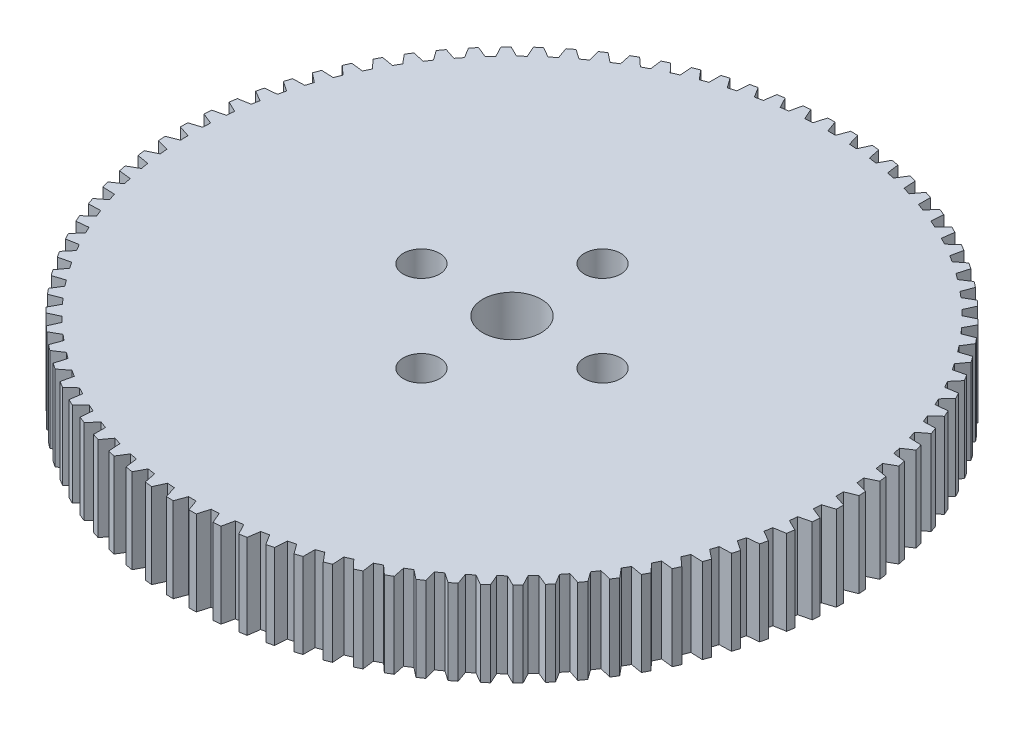
from build123d import *

# Parameters (mm, degrees)
TRACK_PROFILE_V2_DEPTH = 7.5
SKETCH1_R              = 2.575
SKETCH1_R_2            = 1.6
CUT_EXTRUDE1_DEPTH     = 42.834631051


# Read off the part's stored shape, not the designer's step: track_profile_v2
with BuildPart() as part:
    # track_profile_v2 outline → track_profile_v2 (new body)
    with BuildSketch(Plane(origin=(0, 0, 0), x_dir=(1, 0, 0), z_dir=(0, 1, 0))):
        with BuildLine():
            ThreePointArc((-22.430402101, -16.934228255), (-22.226959616, -17.200386369), (-22.020359088, -17.464100624))
            Line((-22.020359088, -17.464100624), (-22.584858875, -18.358245412))
            ThreePointArc((-22.584858875, -18.358245412), (-22.382148592, -18.604850158), (-22.17674576, -18.849216761))
            Line((-22.17674576, -18.849216761), (-21.19449072, -18.457643081))
            ThreePointArc((-21.19449072, -18.457643081), (-20.972977559, -18.708961417), (-20.748484524, -18.957621553))
            Line((-20.748484524, -18.957621553), (-21.24923683, -19.888965764))
            ThreePointArc((-21.24923683, -19.888965764), (-21.029818061, -20.120829439), (-20.807869428, -20.350272599))
            Line((-20.807869428, -20.350272599), (-19.855321911, -19.891134126))
            ThreePointArc((-19.855321911, -19.891134126), (-19.616817264, -20.126388286), (-19.375525428, -20.358782856))
            Line((-19.375525428, -20.358782856), (-19.810090639, -21.322789074))
            ThreePointArc((-19.810090639, -21.322789074), (-19.575032371, -21.538782061), (-19.337619248, -21.752183955))
            Line((-19.337619248, -21.752183955), (-18.419419969, -21.227717564))
            ThreePointArc((-18.419419969, -21.227717564), (-18.165085807, -21.445761414), (-17.90817072, -21.660758215))
            Line((-17.90817072, -21.660758215), (-18.274431677, -22.652729899))
            ThreePointArc((-18.274431677, -22.652729899), (-18.024879091, -22.851799902), (-17.77315813, -23.048120858))
            Line((-17.77315813, -23.048120858), (-16.893780465, -22.460881697))
            ThreePointArc((-16.893780465, -22.460881697), (-16.624855878, -22.660652948), (-16.353569205, -22.857204537))
            Line((-16.353569205, -22.857204537), (-16.649741522, -23.872308901))
            ThreePointArc((-16.649741522, -23.872308901), (-16.386910411, -24.053486071), (-16.122107973, -24.231769632))
            Line((-16.122107973, -24.231769632), (-15.285836161, -23.584618671))
            ThreePointArc((-15.285836161, -23.584618671), (-15.003631322, -23.765144059), (-14.719294744, -23.942292857))
            Line((-14.719294744, -23.942292857), (-14.943935499, -24.975584414))
            ThreePointArc((-14.943935499, -24.975584414), (-14.669106352, -25.137986074), (-14.392512526, -25.297363661))
            Line((-14.392512526, -25.297363661), (-13.603420799, -24.593453754))
            ThreePointArc((-13.603420799, -24.593453754), (-13.309310583, -24.753853777), (-13.013309359, -24.910736732))
            Line((-13.013309359, -24.910736732), (-13.165324125, -25.957181389))
            ThreePointArc((-13.165324125, -25.957181389), (-12.87983588, -26.100016335), (-12.592798205, -26.239711477))
            Line((-12.592798205, -26.239711477), (-11.854730939, -25.482472003))
            ThreePointArc((-11.854730939, -25.482472003), (-11.55014822, -25.621965207), (-11.243924438, -25.757818002))
            Line((-11.243924438, -25.757818002), (-11.322572615, -26.812317587))
            ThreePointArc((-11.322572615, -26.812317587), (-11.027816143, -26.934889941), (-10.731733037, -27.054222056))
            Line((-10.731733037, -27.054222056), (-10.048286021, -26.247342209))
            ThreePointArc((-10.048286021, -26.247342209), (-9.734714696, -26.365248999), (-9.419760248, -26.479409772))
            Line((-9.419760248, -26.479409772), (-9.424658669, -27.536826868))
            ThreePointArc((-9.424658669, -27.536826868), (-9.122069994, -27.63853947), (-8.818383944, -27.736927184))
            Line((-8.818383944, -27.736927184), (-8.192886863, -26.884338003))
            ThreePointArc((-8.192886863, -26.884338003), (-7.871854621, -26.980083948), (-7.549703933, -27.071996519))
            Line((-7.549703933, -27.071996519), (-7.480828734, -28.127179497))
            ThreePointArc((-7.480828734, -28.127179497), (-7.171882037, -28.207536813), (-6.862072571, -28.284500792))
            Line((-6.862072571, -28.284500792), (-6.297572785, -27.390356004))
            ThreePointArc((-6.297572785, -27.390356004), (-5.970643662, -27.463474639), (-5.64286622, -27.53269122))
            Line((-5.64286622, -27.53269122), (-5.500552953, -28.580499334))
            ThreePointArc((-5.500552953, -28.580499334), (-5.186753392, -28.639109872), (-4.87232987, -28.694275154))
            Line((-4.87232987, -28.694275154), (-4.371577564, -27.762930944))
            ThreePointArc((-4.371577564, -27.762930944), (-4.040344326, -27.813066043), (-3.708537029, -27.859249417))
            Line((-3.708537029, -27.859249417), (-3.493479031, -28.894577852))
            ThreePointArc((-3.493479031, -28.894577852), (-3.176355406, -28.931156066), (-2.858849668, -28.964253893))
            Line((-2.858849668, -28.964253893), (-2.424284458, -28.000247675))
            ThreePointArc((-2.424284458, -28.000247675), (-2.090360839, -28.027154985), (-1.756140219, -28.050080152))
            Line((-1.756140219, -28.050080152), (-1.469385231, -29.067884891))
            ThreePointArc((-1.469385231, -29.067884891), (-1.150482535, -29.082252577), (-0.831441438, -29.093121698))
            Line((-0.831441438, -29.093121698), (-0.465180481, -28.101150014))
            ThreePointArc((-0.465180481, -28.101150014), (-0.130193325, -28.104698445), (0.20481233, -28.104253716))
            Line((0.20481233, -28.104253716), (0.561867267, -29.099576117))
            ThreePointArc((0.561867267, -29.099576117), (0.880995371, -29.091663276), (1.200017492, -29.080250739))
            Line((1.200017492, -29.080250739), (1.496189809, -28.065146375))
            ThreePointArc((1.496189809, -28.065146375), (1.830608479, -28.04531864), (2.164767054, -28.02150618))
            Line((2.164767054, -28.02150618), (2.590382404, -28.989497133))
            ThreePointArc((2.590382404, -28.989497133), (2.908181156, -28.959342316), (3.225630056, -28.925703721))
            Line((3.225630056, -28.925703721), (3.450270812, -27.892412164))
            ThreePointArc((3.450270812, -27.892412164), (3.782491743, -27.849304861), (4.114175251, -27.802240683))
            Line((4.114175251, -27.802240683), (4.606277458, -28.738184232))
            ThreePointArc((4.606277458, -28.738184232), (4.921198575, -28.685934351), (5.235527676, -28.630233582))
            Line((5.235527676, -28.630233582), (5.387542442, -27.583788925))
            ThreePointArc((5.387542442, -27.583788925), (5.715947086, -27.517612068), (6.043539599, -27.447525464))
            Line((6.043539599, -27.447525464), (6.599731192, -28.346861787))
            ThreePointArc((6.599731192, -28.346861787), (6.910240409, -28.272771398), (7.219918331, -28.195279823))
            Line((7.219918331, -28.195279823), (7.298566507, -27.140780238))
            ThreePointArc((7.298566507, -27.140780238), (7.621554909, -27.051856235), (7.943460429, -26.959088661))
            Line((7.943460429, -26.959088661), (8.561031698, -27.817436281))
            ThreePointArc((8.561031698, -27.817436281), (8.865616246, -27.721866344), (9.169134269, -27.622961495))
            Line((9.169134269, -27.622961495), (9.17403269, -26.565544399))
            ThreePointArc((9.17403269, -26.565544399), (9.490031284, -26.454306478), (9.804681519, -26.339309887))
            Line((9.804681519, -26.339309887), (10.480623719, -27.152487022))
            ThreePointArc((10.480623719, -27.152487022), (10.777799692, -27.035903144), (11.073679107, -26.916066875))
            Line((11.073679107, -26.916066875), (11.004803908, -25.860883897))
            ThreePointArc((11.004803908, -25.860883897), (11.31227318, -25.727873999), (11.618135187, -25.591208643))
            Line((11.618135187, -25.591208643), (12.349155194, -26.355253575))
            ThreePointArc((12.349155194, -26.355253575), (12.637474781, -26.218223741), (12.924274094, -26.078039883))
            Line((12.924274094, -26.078039883), (12.781960827, -25.030231769))
            ThreePointArc((12.781960827, -25.030231769), (13.079402818, -24.876097904), (13.374986467, -24.718429602))
            Line((13.374986467, -24.718429602), (14.157522827, -25.429619982))
            ThreePointArc((14.157522827, -25.429619982), (14.435581364, -25.272811788), (14.711903316, -25.112963302))
            Line((14.711903316, -25.112963302), (14.496845319, -24.077634867))
            ThreePointArc((14.496845319, -24.077634867), (14.782810921, -23.90312796), (15.066676158, -23.725224858))
            Line((15.066676158, -23.725224858), (15.896916431, -24.380095836))
            ThreePointArc((15.896916431, -24.380095836), (16.163359245, -24.204273236), (16.427857624, -24.025538888))
            Line((16.427857624, -24.025538888), (16.141102636, -23.007734149))
            ThreePointArc((16.141102636, -23.007734149), (16.414198654, -22.81370438), (16.684962517, -22.616433203))
            Line((16.684962517, -22.616433203), (17.558861857, -23.211794314))
            ThreePointArc((17.558861857, -23.211794314), (17.812390865, -23.017813899), (18.063777061, -22.821064464))
            Line((18.063777061, -22.821064464), (17.706722125, -21.825742063))
            ThreePointArc((17.706722125, -21.825742063), (17.965618062, -21.613134725), (18.221961415, -21.397456559))
            Line((18.221961415, -21.397456559), (19.135262273, -21.930407264))
            ThreePointArc((19.135262273, -21.930407264), (19.374642307, -21.719214085), (19.611691592, -21.505408108))
            Line((19.611691592, -21.505408108), (19.186076243, -20.537417155))
            ThreePointArc((19.186076243, -20.537417155), (19.429510784, -20.307268051), (19.67018475, -20.074233657))
            Line((19.67018475, -20.074233657), (20.618437614, -20.542177474))
            ThreePointArc((20.618437614, -20.542177474), (20.842502439, -20.314800444), (21.064059933, -20.084979565))
            Line((21.064059933, -20.084979565), (20.571957726, -19.149036016))
            ThreePointArc((20.571957726, -19.149036016), (20.798744883, -18.902466407), (21.022576921, -18.653211106))
            Line((21.022576921, -18.653211106), (22.001162, -19.05386826))
            ThreePointArc((22.001162, -19.05386826), (22.208819995, -18.811415137), (22.413806292, -18.56669902))
            Line((22.413806292, -18.56669902), (21.857614699, -17.667362697))
            ThreePointArc((21.857614699, -17.667362697), (22.066649588, -17.405573848), (22.272549211, -17.141311987))
            Line((22.272549211, -17.141311987), (23.276698936, -17.472730515))
            ThreePointArc((23.276698936, -17.472730515), (23.466938411, -17.216382506), (23.654354839, -16.957963385))
            Line((23.654354839, -16.957963385), (23.03678357, -16.099615764))
            ThreePointArc((23.03678357, -16.099615764), (23.227047793, -15.823883082), (23.414011881, -15.545902118))
            Line((23.414011881, -15.545902118), (24.438834135, -15.806467383))
            ThreePointArc((24.438834135, -15.806467383), (24.610728263, -15.53747339), (24.779661747, -15.266610256))
            Line((24.779661747, -15.266610256), (24.103719547, -14.453433121))
            ThreePointArc((24.103719547, -14.453433121), (24.274286157, -14.165099949), (24.441403837, -13.874754177))
            Line((24.441403837, -13.874754177), (25.48190579, -14.063196732))
            ThreePointArc((25.48190579, -14.063196732), (25.634617121, -13.782867267), (25.784244634, -13.500879737))
            Line((25.784244634, -13.500879737), (25.053224626, -12.736834804))
            ThreePointArc((25.053224626, -12.736834804), (25.203262639, -12.437305872), (25.349719731, -12.136009828))
            Line((25.349719731, -12.136009828), (26.400832162, -12.251411599))
            ThreePointArc((26.400832162, -12.251411599), (26.5336167, -11.961112398), (26.663209273, -11.669374288))
            Line((26.663209273, -11.669374288), (25.880672913, -10.958183909))
            ThreePointArc((25.880672913, -10.958183909), (26.009451358, -10.648918492), (26.134534339, -10.338140059))
            Line((26.134534339, -10.338140059), (27.191136333, -10.37993882))
            ThreePointArc((27.191136333, -10.37993882), (27.303347167, -10.081084193), (27.412273436, -9.781016821))
            Line((27.412273436, -9.781016821), (26.582033162, -9.126145843))
            ThreePointArc((26.582033162, -9.126145843), (26.688924645, -8.808650651), (26.792024123, -8.489903911))
            Line((26.792024123, -8.489903911), (27.848968021, -8.457896024))
            ThreePointArc((27.848968021, -8.457896024), (27.94005847, -8.151941959), (28.027787759, -7.845007224))
            Line((28.027787759, -7.845007224), (27.153888419, -7.249646112))
            ThreePointArc((27.153888419, -7.249646112), (27.238372174, -6.925467949), (27.318985858, -6.600305804))
            Line((27.318985858, -6.600305804), (28.371122337, -6.494647207))
            ThreePointArc((28.371122337, -6.494647207), (28.440648617, -6.183084283), (28.506753517, -5.87077754))
            Line((28.506753517, -5.87077754), (27.59345266, -5.337826834))
            ThreePointArc((27.59345266, -5.337826834), (27.655117091, -5.008545064), (27.71285224, -4.678551672))
            Line((27.71285224, -4.678551672), (28.755055396, -4.499757123))
            ThreePointArc((28.755055396, -4.499757123), (28.802678783, -4.184103242), (28.846837238, -3.867946017))
            Line((28.846837238, -3.867946017), (27.898584373, -3.4000022))
            ThreePointArc((27.898584373, -3.4000022), (27.937129058, -3.06722105), (27.971704391, -2.734004105))
            Line((27.971704391, -2.734004105), (28.998896716, -2.482944674))
            ThreePointArc((28.998896716, -2.482944674), (29.024385193, -2.16473767), (29.046382067, -1.846270251))
            Line((29.046382067, -1.846270251), (28.067796988, -1.445613098))
            ThreePointArc((28.067796988, -1.445613098), (28.083034141, -1.110953845), (28.094281211, -0.776136746))
            Line((28.094281211, -0.776136746), (29.101458326, -0.454035568))
            ThreePointArc((29.101458326, -0.454035568), (29.104687716, -0.134825714), (29.104415842, 0.184400359))
            Line((29.104415842, 0.184400359), (28.100266118, 0.515818887))
            ThreePointArc((28.100266118, 0.515818887), (28.092121504, 0.850725817), (28.079985516, 1.185511874))
            Line((28.079985516, 1.185511874), (29.062240556, 1.577085553))
            ThreePointArc((29.062240556, 1.577085553), (29.043195126, 1.895743098), (29.020655829, 2.214172588))
            Line((29.020655829, 2.214172588), (27.995833575, 2.474737854))
            ThreePointArc((27.995833575, 2.474737854), (27.964346875, 2.808260828), (27.928886955, 3.141384799))
            Line((27.928886955, 3.141384799), (28.881434472, 3.600523273))
            ThreePointArc((28.881434472, 3.600523273), (28.840207008, 3.917076042), (28.795510098, 4.233157591))
            Line((28.795510098, 4.233157591), (27.755008145, 4.421600146))
            ThreePointArc((27.755008145, 4.421600146), (27.700332758, 4.752114273), (27.641721664, 5.081953213))
            Line((27.641721664, 5.081953213), (28.559920942, 5.606419604))
            ThreePointArc((28.559920942, 5.606419604), (28.496712301, 5.919325384), (28.430075536, 6.231519076))
            Line((28.430075536, 6.231519076), (27.378963106, 6.346920848))
            ThreePointArc((27.378963106, 6.346920848), (27.301365405, 6.672815897), (27.219888683, 6.997762862))
            Line((27.219888683, 6.997762862), (28.099266348, 7.585002023))
            ThreePointArc((28.099266348, 7.585002023), (28.014384477, 7.892736369), (27.926132504, 8.199521227))
            Line((27.926132504, 8.199521227), (26.86953051, 8.241319988))
            ThreePointArc((26.86953051, 8.241319988), (26.769388545, 8.561008232), (26.665443141, 8.879480114))
            Line((26.665443141, 8.879480114), (27.501714953, 9.526631075))
            ThreePointArc((27.501714953, 9.526631075), (27.395573387, 9.827694735), (27.286136162, 10.127576134))
            Line((27.286136162, 10.127576134), (26.229192263, 10.095568247))
            ThreePointArc((26.229192263, 10.095568247), (26.106993914, 10.407492196), (25.98108624, 10.717937431))
            Line((25.98108624, 10.717937431), (26.770177967, 11.421847337))
            ThreePointArc((26.770177967, 11.421847337), (26.643293817, 11.71477356), (26.513204507, 12.006290508))
            Line((26.513204507, 12.006290508), (25.461068028, 11.900631911))
            ThreePointArc((25.461068028, 11.900631911), (25.317408632, 12.203271903), (25.170152099, 12.504178034))
            Line((25.170152099, 12.504178034), (25.908219365, 13.261417508))
            ThreePointArc((25.908219365, 13.261417508), (25.761210798, 13.544779186), (25.611103185, 13.826511442))
            Line((25.611103185, 13.826511442), (24.568900028, 13.647716893))
            ThreePointArc((24.568900028, 13.647716893), (24.404479481, 13.939598496), (24.236591507, 14.229499539))
            Line((24.236591507, 14.229499539), (24.920038523, 15.036379385))
            ThreePointArc((24.920038523, 15.036379385), (24.75362175, 15.30879601), (24.584227142, 15.579371002))
            Line((24.584227142, 15.579371002), (23.557034817, 15.328311571))
            ThreePointArc((23.557034817, 15.328311571), (23.372654159, 15.608012767), (23.184952677, 15.885496352))
            Line((23.184952677, 15.885496352), (23.810449758, 16.738085534))
            ThreePointArc((23.810449758, 16.738085534), (23.625435544, 16.998229917), (23.437579216, 17.256329432))
            Line((23.437579216, 17.256329432), (22.430402101, 16.934228255))
            ThreePointArc((22.430402101, 16.934228255), (22.226959616, 17.200386369), (22.020359088, 17.464100624))
            Line((22.020359088, 17.464100624), (22.584858875, 18.358245412))
            ThreePointArc((22.584858875, 18.358245412), (22.382148592, 18.604850158), (22.17674576, 18.849216761))
            Line((22.17674576, 18.849216761), (21.19449072, 18.457643081))
            ThreePointArc((21.19449072, 18.457643081), (20.972977559, 18.708961417), (20.748484524, 18.957621553))
            Line((20.748484524, 18.957621553), (21.24923683, 19.888965764))
            ThreePointArc((21.24923683, 19.888965764), (21.029818061, 20.120829439), (20.807869428, 20.350272599))
            Line((20.807869428, 20.350272599), (19.855321911, 19.891134126))
            ThreePointArc((19.855321911, 19.891134126), (19.616817264, 20.126388286), (19.375525428, 20.358782856))
            Line((19.375525428, 20.358782856), (19.810090639, 21.322789074))
            ThreePointArc((19.810090639, 21.322789074), (19.575032371, 21.538782061), (19.337619248, 21.752183955))
            Line((19.337619248, 21.752183955), (18.419419969, 21.227717564))
            ThreePointArc((18.419419969, 21.227717564), (18.165085807, 21.445761414), (17.90817072, 21.660758215))
            Line((17.90817072, 21.660758215), (18.274431677, 22.652729899))
            ThreePointArc((18.274431677, 22.652729899), (18.024879091, 22.851799902), (17.77315813, 23.048120858))
            Line((17.77315813, 23.048120858), (16.893780465, 22.460881697))
            ThreePointArc((16.893780465, 22.460881697), (16.624855878, 22.660652948), (16.353569205, 22.857204537))
            Line((16.353569205, 22.857204537), (16.649741522, 23.872308901))
            ThreePointArc((16.649741522, 23.872308901), (16.386910411, 24.053486071), (16.122107973, 24.231769632))
            Line((16.122107973, 24.231769632), (15.285836161, 23.584618671))
            ThreePointArc((15.285836161, 23.584618671), (15.003631322, 23.765144059), (14.719294744, 23.942292857))
            Line((14.719294744, 23.942292857), (14.943935499, 24.975584414))
            ThreePointArc((14.943935499, 24.975584414), (14.669106352, 25.137986074), (14.392512526, 25.297363661))
            Line((14.392512526, 25.297363661), (13.603420799, 24.593453754))
            ThreePointArc((13.603420799, 24.593453754), (13.309310583, 24.753853777), (13.013309359, 24.910736732))
            Line((13.013309359, 24.910736732), (13.165324125, 25.957181389))
            ThreePointArc((13.165324125, 25.957181389), (12.87983588, 26.100016335), (12.592798205, 26.239711477))
            Line((12.592798205, 26.239711477), (11.854730939, 25.482472003))
            ThreePointArc((11.854730939, 25.482472003), (11.55014822, 25.621965207), (11.243924438, 25.757818002))
            Line((11.243924438, 25.757818002), (11.322572615, 26.812317587))
            ThreePointArc((11.322572615, 26.812317587), (11.027816143, 26.934889941), (10.731733037, 27.054222056))
            Line((10.731733037, 27.054222056), (10.048286021, 26.247342209))
            ThreePointArc((10.048286021, 26.247342209), (9.734714696, 26.365248999), (9.419760248, 26.479409772))
            Line((9.419760248, 26.479409772), (9.424658669, 27.536826868))
            ThreePointArc((9.424658669, 27.536826868), (9.122069994, 27.63853947), (8.818383944, 27.736927184))
            Line((8.818383944, 27.736927184), (8.192886863, 26.884338003))
            ThreePointArc((8.192886863, 26.884338003), (7.871854621, 26.980083948), (7.549703933, 27.071996519))
            Line((7.549703933, 27.071996519), (7.480828734, 28.127179497))
            ThreePointArc((7.480828734, 28.127179497), (7.171882037, 28.207536813), (6.862072571, 28.284500792))
            Line((6.862072571, 28.284500792), (6.297572785, 27.390356004))
            ThreePointArc((6.297572785, 27.390356004), (5.970643662, 27.463474639), (5.64286622, 27.53269122))
            Line((5.64286622, 27.53269122), (5.500552953, 28.580499334))
            ThreePointArc((5.500552953, 28.580499334), (5.186753392, 28.639109872), (4.87232987, 28.694275154))
            Line((4.87232987, 28.694275154), (4.371577564, 27.762930944))
            ThreePointArc((4.371577564, 27.762930944), (4.040344326, 27.813066043), (3.708537029, 27.859249417))
            Line((3.708537029, 27.859249417), (3.493479031, 28.894577852))
            ThreePointArc((3.493479031, 28.894577852), (3.176355406, 28.931156066), (2.858849668, 28.964253893))
            Line((2.858849668, 28.964253893), (2.424284458, 28.000247675))
            ThreePointArc((2.424284458, 28.000247675), (2.090360839, 28.027154985), (1.756140219, 28.050080152))
            Line((1.756140219, 28.050080152), (1.469385231, 29.067884891))
            ThreePointArc((1.469385231, 29.067884891), (1.150482535, 29.082252577), (0.831441438, 29.093121698))
            Line((0.831441438, 29.093121698), (0.465180481, 28.101150014))
            ThreePointArc((0.465180481, 28.101150014), (0.130193325, 28.104698445), (-0.20481233, 28.104253716))
            Line((-0.20481233, 28.104253716), (-0.561867267, 29.099576117))
            ThreePointArc((-0.561867267, 29.099576117), (-0.880995371, 29.091663276), (-1.200017492, 29.080250739))
            Line((-1.200017492, 29.080250739), (-1.496189809, 28.065146375))
            ThreePointArc((-1.496189809, 28.065146375), (-1.830608479, 28.04531864), (-2.164767054, 28.02150618))
            Line((-2.164767054, 28.02150618), (-2.590382404, 28.989497133))
            ThreePointArc((-2.590382404, 28.989497133), (-2.908181156, 28.959342316), (-3.225630056, 28.925703721))
            Line((-3.225630056, 28.925703721), (-3.450270812, 27.892412164))
            ThreePointArc((-3.450270812, 27.892412164), (-3.782491743, 27.849304861), (-4.114175251, 27.802240683))
            Line((-4.114175251, 27.802240683), (-4.606277458, 28.738184232))
            ThreePointArc((-4.606277458, 28.738184232), (-4.921198575, 28.685934351), (-5.235527676, 28.630233582))
            Line((-5.235527676, 28.630233582), (-5.387542442, 27.583788925))
            ThreePointArc((-5.387542442, 27.583788925), (-5.715947086, 27.517612068), (-6.043539599, 27.447525464))
            Line((-6.043539599, 27.447525464), (-6.599731192, 28.346861787))
            ThreePointArc((-6.599731192, 28.346861787), (-6.910240409, 28.272771398), (-7.219918331, 28.195279823))
            Line((-7.219918331, 28.195279823), (-7.298566507, 27.140780238))
            ThreePointArc((-7.298566507, 27.140780238), (-7.621554909, 27.051856235), (-7.943460429, 26.959088661))
            Line((-7.943460429, 26.959088661), (-8.561031698, 27.817436281))
            ThreePointArc((-8.561031698, 27.817436281), (-8.865616246, 27.721866344), (-9.169134269, 27.622961495))
            Line((-9.169134269, 27.622961495), (-9.17403269, 26.565544399))
            ThreePointArc((-9.17403269, 26.565544399), (-9.490031284, 26.454306478), (-9.804681519, 26.339309887))
            Line((-9.804681519, 26.339309887), (-10.480623719, 27.152487022))
            ThreePointArc((-10.480623719, 27.152487022), (-10.777799692, 27.035903144), (-11.073679107, 26.916066875))
            Line((-11.073679107, 26.916066875), (-11.004803908, 25.860883897))
            ThreePointArc((-11.004803908, 25.860883897), (-11.31227318, 25.727873999), (-11.618135187, 25.591208643))
            Line((-11.618135187, 25.591208643), (-12.349155194, 26.355253575))
            ThreePointArc((-12.349155194, 26.355253575), (-12.637474781, 26.218223741), (-12.924274094, 26.078039883))
            Line((-12.924274094, 26.078039883), (-12.781960827, 25.030231769))
            ThreePointArc((-12.781960827, 25.030231769), (-13.079402818, 24.876097904), (-13.374986467, 24.718429602))
            Line((-13.374986467, 24.718429602), (-14.157522827, 25.429619982))
            ThreePointArc((-14.157522827, 25.429619982), (-14.435581364, 25.272811788), (-14.711903316, 25.112963302))
            Line((-14.711903316, 25.112963302), (-14.496845319, 24.077634867))
            ThreePointArc((-14.496845319, 24.077634867), (-14.782810921, 23.90312796), (-15.066676158, 23.725224858))
            Line((-15.066676158, 23.725224858), (-15.896916431, 24.380095836))
            ThreePointArc((-15.896916431, 24.380095836), (-16.163359245, 24.204273236), (-16.427857624, 24.025538888))
            Line((-16.427857624, 24.025538888), (-16.141102636, 23.007734149))
            ThreePointArc((-16.141102636, 23.007734149), (-16.414198654, 22.81370438), (-16.684962517, 22.616433203))
            Line((-16.684962517, 22.616433203), (-17.558861857, 23.211794314))
            ThreePointArc((-17.558861857, 23.211794314), (-17.812390865, 23.017813899), (-18.063777061, 22.821064464))
            Line((-18.063777061, 22.821064464), (-17.706722125, 21.825742063))
            ThreePointArc((-17.706722125, 21.825742063), (-17.965618062, 21.613134725), (-18.221961415, 21.397456559))
            Line((-18.221961415, 21.397456559), (-19.135262273, 21.930407264))
            ThreePointArc((-19.135262273, 21.930407264), (-19.374642307, 21.719214085), (-19.611691592, 21.505408108))
            Line((-19.611691592, 21.505408108), (-19.186076243, 20.537417155))
            ThreePointArc((-19.186076243, 20.537417155), (-19.429510784, 20.307268051), (-19.67018475, 20.074233657))
            Line((-19.67018475, 20.074233657), (-20.618437614, 20.542177474))
            ThreePointArc((-20.618437614, 20.542177474), (-20.842502439, 20.314800444), (-21.064059933, 20.084979565))
            Line((-21.064059933, 20.084979565), (-20.571957726, 19.149036016))
            ThreePointArc((-20.571957726, 19.149036016), (-20.798744883, 18.902466407), (-21.022576921, 18.653211106))
            Line((-21.022576921, 18.653211106), (-22.001162, 19.05386826))
            ThreePointArc((-22.001162, 19.05386826), (-22.208819995, 18.811415137), (-22.413806292, 18.56669902))
            Line((-22.413806292, 18.56669902), (-21.857614699, 17.667362697))
            ThreePointArc((-21.857614699, 17.667362697), (-22.066649588, 17.405573848), (-22.272549211, 17.141311987))
            Line((-22.272549211, 17.141311987), (-23.276698936, 17.472730515))
            ThreePointArc((-23.276698936, 17.472730515), (-23.466938411, 17.216382506), (-23.654354839, 16.957963385))
            Line((-23.654354839, 16.957963385), (-23.03678357, 16.099615764))
            ThreePointArc((-23.03678357, 16.099615764), (-23.227047793, 15.823883082), (-23.414011881, 15.545902118))
            Line((-23.414011881, 15.545902118), (-24.438834135, 15.806467383))
            ThreePointArc((-24.438834135, 15.806467383), (-24.610728263, 15.53747339), (-24.779661747, 15.266610256))
            Line((-24.779661747, 15.266610256), (-24.103719547, 14.453433121))
            ThreePointArc((-24.103719547, 14.453433121), (-24.274286157, 14.165099949), (-24.441403837, 13.874754177))
            Line((-24.441403837, 13.874754177), (-25.48190579, 14.063196732))
            ThreePointArc((-25.48190579, 14.063196732), (-25.634617121, 13.782867267), (-25.784244634, 13.500879737))
            Line((-25.784244634, 13.500879737), (-25.053224626, 12.736834804))
            ThreePointArc((-25.053224626, 12.736834804), (-25.203262639, 12.437305872), (-25.349719731, 12.136009828))
            Line((-25.349719731, 12.136009828), (-26.400832162, 12.251411599))
            ThreePointArc((-26.400832162, 12.251411599), (-26.5336167, 11.961112398), (-26.663209273, 11.669374288))
            Line((-26.663209273, 11.669374288), (-25.880672913, 10.958183909))
            ThreePointArc((-25.880672913, 10.958183909), (-26.009451358, 10.648918492), (-26.134534339, 10.338140059))
            Line((-26.134534339, 10.338140059), (-27.191136333, 10.37993882))
            ThreePointArc((-27.191136333, 10.37993882), (-27.303347167, 10.081084193), (-27.412273436, 9.781016821))
            Line((-27.412273436, 9.781016821), (-26.582033162, 9.126145843))
            ThreePointArc((-26.582033162, 9.126145843), (-26.688924645, 8.808650651), (-26.792024123, 8.489903911))
            Line((-26.792024123, 8.489903911), (-27.848968021, 8.457896024))
            ThreePointArc((-27.848968021, 8.457896024), (-27.94005847, 8.151941959), (-28.027787759, 7.845007224))
            Line((-28.027787759, 7.845007224), (-27.153888419, 7.249646112))
            ThreePointArc((-27.153888419, 7.249646112), (-27.238372174, 6.925467949), (-27.318985858, 6.600305804))
            Line((-27.318985858, 6.600305804), (-28.371122337, 6.494647207))
            ThreePointArc((-28.371122337, 6.494647207), (-28.440648617, 6.183084283), (-28.506753517, 5.87077754))
            Line((-28.506753517, 5.87077754), (-27.59345266, 5.337826834))
            ThreePointArc((-27.59345266, 5.337826834), (-27.655117091, 5.008545064), (-27.71285224, 4.678551672))
            Line((-27.71285224, 4.678551672), (-28.755055396, 4.499757123))
            ThreePointArc((-28.755055396, 4.499757123), (-28.802678783, 4.184103242), (-28.846837238, 3.867946017))
            Line((-28.846837238, 3.867946017), (-27.898584373, 3.4000022))
            ThreePointArc((-27.898584373, 3.4000022), (-27.937129058, 3.06722105), (-27.971704391, 2.734004105))
            Line((-27.971704391, 2.734004105), (-28.998896716, 2.482944674))
            ThreePointArc((-28.998896716, 2.482944674), (-29.024385193, 2.16473767), (-29.046382067, 1.846270251))
            Line((-29.046382067, 1.846270251), (-28.067796988, 1.445613098))
            ThreePointArc((-28.067796988, 1.445613098), (-28.083034141, 1.110953845), (-28.094281211, 0.776136746))
            Line((-28.094281211, 0.776136746), (-29.101458326, 0.454035568))
            ThreePointArc((-29.101458326, 0.454035568), (-29.104687716, 0.134825714), (-29.104415842, -0.184400359))
            Line((-29.104415842, -0.184400359), (-28.100266118, -0.515818887))
            ThreePointArc((-28.100266118, -0.515818887), (-28.092121504, -0.850725817), (-28.079985516, -1.185511874))
            Line((-28.079985516, -1.185511874), (-29.062240556, -1.577085553))
            ThreePointArc((-29.062240556, -1.577085553), (-29.043195126, -1.895743098), (-29.020655829, -2.214172588))
            Line((-29.020655829, -2.214172588), (-27.995833575, -2.474737854))
            ThreePointArc((-27.995833575, -2.474737854), (-27.964346875, -2.808260828), (-27.928886955, -3.141384799))
            Line((-27.928886955, -3.141384799), (-28.881434472, -3.600523273))
            ThreePointArc((-28.881434472, -3.600523273), (-28.840207008, -3.917076042), (-28.795510098, -4.233157591))
            Line((-28.795510098, -4.233157591), (-27.755008145, -4.421600146))
            ThreePointArc((-27.755008145, -4.421600146), (-27.700332758, -4.752114273), (-27.641721664, -5.081953213))
            Line((-27.641721664, -5.081953213), (-28.559920942, -5.606419604))
            ThreePointArc((-28.559920942, -5.606419604), (-28.496712301, -5.919325384), (-28.430075536, -6.231519076))
            Line((-28.430075536, -6.231519076), (-27.378963106, -6.346920848))
            ThreePointArc((-27.378963106, -6.346920848), (-27.301365405, -6.672815897), (-27.219888683, -6.997762862))
            Line((-27.219888683, -6.997762862), (-28.099266348, -7.585002023))
            ThreePointArc((-28.099266348, -7.585002023), (-28.014384477, -7.892736369), (-27.926132504, -8.199521227))
            Line((-27.926132504, -8.199521227), (-26.86953051, -8.241319988))
            ThreePointArc((-26.86953051, -8.241319988), (-26.769388545, -8.561008232), (-26.665443141, -8.879480114))
            Line((-26.665443141, -8.879480114), (-27.501714953, -9.526631075))
            ThreePointArc((-27.501714953, -9.526631075), (-27.395573387, -9.827694735), (-27.286136162, -10.127576134))
            Line((-27.286136162, -10.127576134), (-26.229192263, -10.095568247))
            ThreePointArc((-26.229192263, -10.095568247), (-26.106993914, -10.407492196), (-25.98108624, -10.717937431))
            Line((-25.98108624, -10.717937431), (-26.770177967, -11.421847337))
            ThreePointArc((-26.770177967, -11.421847337), (-26.643293817, -11.71477356), (-26.513204507, -12.006290508))
            Line((-26.513204507, -12.006290508), (-25.461068028, -11.900631911))
            ThreePointArc((-25.461068028, -11.900631911), (-25.317408632, -12.203271903), (-25.170152099, -12.504178034))
            Line((-25.170152099, -12.504178034), (-25.908219365, -13.261417508))
            ThreePointArc((-25.908219365, -13.261417508), (-25.761210798, -13.544779186), (-25.611103185, -13.826511442))
            Line((-25.611103185, -13.826511442), (-24.568900028, -13.647716893))
            ThreePointArc((-24.568900028, -13.647716893), (-24.404479481, -13.939598496), (-24.236591507, -14.229499539))
            Line((-24.236591507, -14.229499539), (-24.920038523, -15.036379385))
            ThreePointArc((-24.920038523, -15.036379385), (-24.75362175, -15.30879601), (-24.584227142, -15.579371002))
            Line((-24.584227142, -15.579371002), (-23.557034817, -15.328311571))
            ThreePointArc((-23.557034817, -15.328311571), (-23.372654159, -15.608012767), (-23.184952677, -15.885496352))
            Line((-23.184952677, -15.885496352), (-23.810449758, -16.738085534))
            ThreePointArc((-23.810449758, -16.738085534), (-23.625435544, -16.998229917), (-23.437579216, -17.256329432))
            Line((-23.437579216, -17.256329432), (-22.430402101, -16.934228255))
        make_face()
    extrude(amount=TRACK_PROFILE_V2_DEPTH)

    # Sketch1 → Cut-Extrude1 (cut, through all)
    with BuildSketch(Plane(origin=(0, 7.5, 0), x_dir=(1, 0, 0), z_dir=(0, 1, 0))):
        with Locations(Location((0, 0, 0), (0, 0, 270))):
            Circle(SKETCH1_R)
        with Locations(Location((8, 0, 0), (0, 0, 270))):
            Circle(SKETCH1_R_2)
        with Locations(Location((0, -8, 0), (0, 0, 270))):
            Circle(SKETCH1_R_2)
        with Locations(Location((-8, 0, 0), (0, 0, 270))):
            Circle(SKETCH1_R_2)
        with Locations(Location((0, 8, 0), (0, 0, 270))):
            Circle(SKETCH1_R_2)
    extrude(amount=-CUT_EXTRUDE1_DEPTH, mode=Mode.SUBTRACT)


solid = part.part
